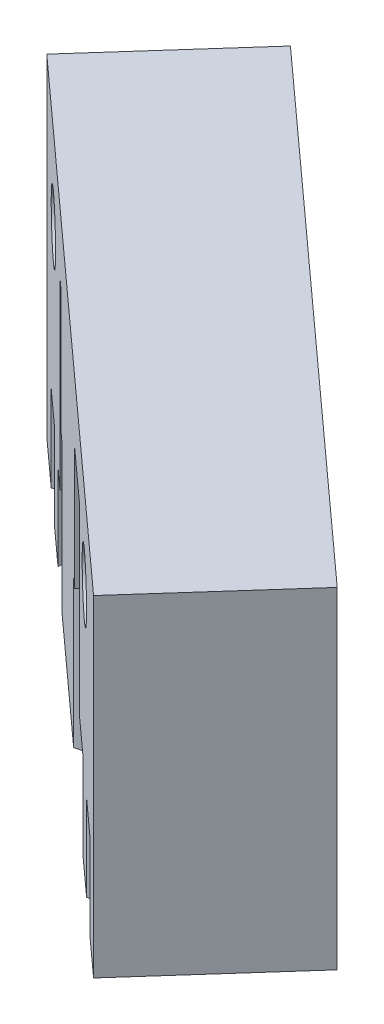
from build123d import *
from build123d.topology import SkipClean

# Parameters (mm, degrees)
SKETCH2_R           = 2.5
BOSS_EXTRUDE1_DEPTH = 7
FILLET1_R           = 90
BOSS_EXTRUDE3_DEPTH = 15
SKETCH4_R           = 8
CUT_EXTRUDE1_DEPTH  = 10
BOSS_EXTRUDE4_START = 10
BOSS_EXTRUDE4_DEPTH = 10
BOSS_EXTRUDE5_DEPTH = 27
SKETCH7_R           = 2.5
CUT_EXTRUDE2_DEPTH  = 37
INTERSECT3_DEPTH    = 27


with BuildPart() as part:
    # Sketch2 → Boss-Extrude1 (new body)
    with BuildSketch(Plane(origin=(0, 0, 0), x_dir=(1, 0, 0), z_dir=(0, 1, 0))):
        with BuildLine():
            Line((-4.24846021, -9.602113613), (13.572308451, -17.486922065))
            ThreePointArc((13.572308451, -17.486922065), (20.638500285, -15.805826469), (20.907079545, -8.547382103))
            Line((20.907079545, -8.547382103), (11.451696022, 4.891208687))
            ThreePointArc((11.451696022, 4.891208687), (9.270724445, 7.034926316), (6.472222222, 8.268031175))
            ThreePointArc((6.472222222, 8.268031175), (4.86754966, 9.30359932), (3.101845071, 10.031378627))
            Line((3.101845071, 10.031378627), (-8.821699821, 13.718308443))
            ThreePointArc((-8.821699821, 13.718308443), (-15.091857172, 11.987583677), (-16.147811194, 5.569231667))
            Line((-16.147811194, 5.569231667), (-12.308520784, -3.358124948))
            ThreePointArc((-12.308520784, -3.358124948), (-9.971976629, -6.504419403), (-6.472222222, -8.268031175))
            ThreePointArc((-6.472222222, -8.268031175), (-5.401685102, -9.003987898), (-4.24846021, -9.602113613))
        make_face()
        with Locations(Location((16, -12, 0), (0, 0, 270))):
            Circle(SKETCH2_R, mode=Mode.SUBTRACT)
        with Locations(Location((-10.604337088, 7.953252816, 0), (0, 0, 270))):
            Circle(SKETCH2_R, mode=Mode.SUBTRACT)
        with BuildLine():
            ThreePointArc((-4.694444444, -4.495797077), (0, -6.5), (4.694444444, -4.495797077))
            ThreePointArc((4.694444444, -4.495797077), (9, 0), (4.694444444, 4.495797077))
            ThreePointArc((4.694444444, 4.495797077), (0, 6.5), (-4.694444444, 4.495797077))
            ThreePointArc((-4.694444444, 4.495797077), (-9, 0), (-4.694444444, -4.495797077))
        make_face(mode=Mode.SUBTRACT)
    extrude(amount=BOSS_EXTRUDE1_DEPTH)

    # Fillet1
    fillet1_edges = [part.edges().sort_by_distance(p)[0] for p in [
        (6.472222222, 3.5, -8.268031175),
        (-6.472222222, 3.5, 8.268031175),
    ]]
    fillet(fillet1_edges, radius=FILLET1_R)

    # Sketch3 → Boss-Extrude3 (add)
    with BuildSketch(Plane(origin=(0, 7, 0), x_dir=(1, 0, 0), z_dir=(0, 1, 0))):
        with BuildLine():
            Line((-13.446880098, 1.012795393), (-12.308520784, -3.358124948))
            ThreePointArc((-12.308520784, -3.358124948), (-10.611843956, -5.907229762), (-8.121968415, -7.689690813))
            ThreePointArc((-8.121968415, -7.689690813), (-6.480430757, -8.483296944), (-4.855306799, -9.309994408))
            ThreePointArc((-4.855306799, -9.309994408), (-4.554226262, -9.460920841), (-4.24846021, -9.602113613))
            Line((-4.24846021, -9.602113613), (-1.454246479, -10.838414946))
            ThreePointArc((-1.454246479, -10.838414946), (10.979115699, -7.880432641), (11.451696022, 4.891208687))
            ThreePointArc((11.451696022, 4.891208687), (9.968863726, 6.507036925), (8.121968415, 7.689690813))
            ThreePointArc((8.121968415, 7.689690813), (6.480430757, 8.483296944), (4.855306799, 9.309994408))
            ThreePointArc((4.855306799, 9.309994408), (3.994892398, 9.710346787), (3.101845071, 10.031378627))
            Line((3.101845071, 10.031378627), (-3.895223267, 11.305534387))
            ThreePointArc((-3.895223267, 11.305534387), (-5.691953988, 10.727471116), (-6.207623157, 8.911848981))
            ThreePointArc((-6.207623157, 8.911848981), (-7.30582589, 4.892236012), (-11.232333003, 3.497288147))
            ThreePointArc((-11.232333003, 3.497288147), (-13.004436636, 2.847636589), (-13.446880098, 1.012795393))
        make_face()
        with BuildLine():
            ThreePointArc((4.694444444, -4.495797077), (9, 0), (4.694444444, 4.495797077))
            ThreePointArc((4.694444444, 4.495797077), (0, 6.5), (-4.694444444, 4.495797077))
            ThreePointArc((-4.694444444, 4.495797077), (-9, 0), (-4.694444444, -4.495797077))
            ThreePointArc((-4.694444444, -4.495797077), (0, -6.5), (4.694444444, -4.495797077))
        make_face(mode=Mode.SUBTRACT)
    extrude(amount=BOSS_EXTRUDE3_DEPTH)

    # Sketch4 → Cut-Extrude1 (cut)
    with BuildSketch(Plane(origin=(0, 22, 0), x_dir=(1, 0, 0), z_dir=(0, 1, 0))):
        Circle(SKETCH4_R)
    extrude(amount=-CUT_EXTRUDE1_DEPTH, mode=Mode.SUBTRACT)

    # Sketch5 → Boss-Extrude4 (add)
    with SkipClean():  # the faces are left unmerged after this step: merging them gives an invalid solid
        with BuildSketch(Plane(origin=(0, 12, 0), x_dir=(1, 0, 0), z_dir=(0, 1, 0)).offset(BOSS_EXTRUDE4_START)):
            with BuildLine():
                ThreePointArc((-7.111111111, 3.664982778), (-8, 0), (-7.111111111, -3.664982778))
                ThreePointArc((-7.111111111, -3.664982778), (-9, 0), (-7.111111111, 3.664982778))
            make_face()
            with BuildLine():
                ThreePointArc((7.111111111, -3.664982778), (9, 0), (7.111111111, 3.664982778))
                ThreePointArc((7.111111111, 3.664982778), (8, 0), (7.111111111, -3.664982778))
            make_face()
        extrude(amount=-BOSS_EXTRUDE4_DEPTH)


with BuildPart() as body_2:
    # Sketch6 → Boss-Extrude5 (new body)
    with BuildSketch(Plane(origin=(0, 0, 0), x_dir=(-1, 0, 0), z_dir=(0, -1, 0))):
        Polygon((8.401052482, 26.937158796), (-31.729302738, -9.377746691), (-13.016359271, -30.388770935), (27.113995949, 5.926134553), align=None)
    extrude(amount=-BOSS_EXTRUDE5_DEPTH)

    # Sketch7 → Cut-Extrude2 (cut)
    with BuildSketch(Plane(origin=(-9.25873614, 0, 10.23151142), x_dir=(0.7414761288495602, 0, 0.670979247329059), z_dir=(-0.670979247329059, 0, 0.7414761288495602))):
        with Locations((-16.542969249, 20.228212297)):
            Circle(SKETCH7_R)
        with Locations((19.254983261, 20.228212297)):
            Circle(SKETCH7_R)
    extrude(amount=-CUT_EXTRUDE2_DEPTH, mode=Mode.SUBTRACT)

    # Intersect1: read off the stored shape, not the designer's step
    # Intersect1: cut part
    add(part.part, mode=Mode.SUBTRACT)

    # Intersect3: read off the stored shape, not the designer's step
    # Intersect3 outline → Intersect3 (cut)
    with BuildSketch(Plane(origin=(0, 0, 0), x_dir=(1, 0, 0), z_dir=(0, 1, 0))):
        Polygon((13.016359271, -30.388770935), (22.372831004, -19.883258813), (-17.757524216, 16.431646675), (-27.113995949, 5.926134553), align=None)
    extrude(amount=INTERSECT3_DEPTH, mode=Mode.SUBTRACT)


solid = body_2.part
